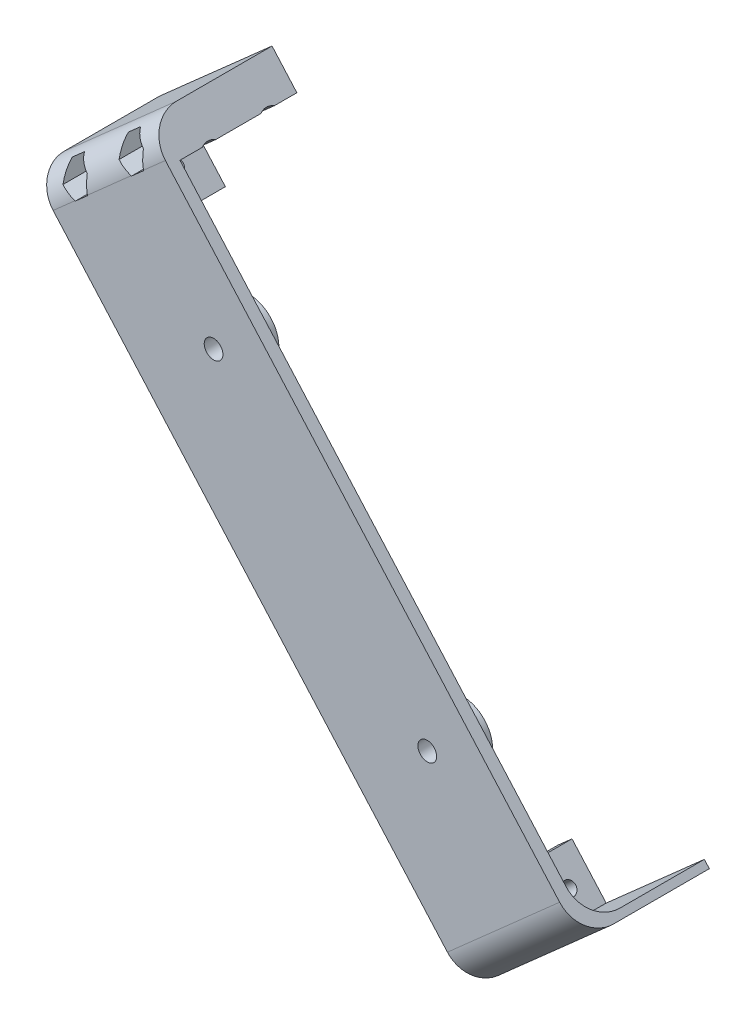
from build123d import *

# Parameters (mm, degrees)
SKETCH1_R                   = 10.2489
BOSS_EXTRUDE1_DEPTH         = 2.9845
BOSS_EXTRUDE1_2_DEPTH       = 2.9845
SKETCH2_R                   = 10.2489
BOSS_EXTRUDE2_DEPTH         = 5.08
BOSS_EXTRUDE3_DEPTH         = 3.81
F_1_4_0_25_DIAMETER_HOLE1_D = 6.35
BOSS_EXTRUDE4_DEPTH         = 17.78
SKETCH8_R                   = 2.25
CUT_EXTRUDE1_DEPTH          = 17.78
SKETCH9_W                   = 17.78
SKETCH9_H                   = 2.54
BOSS_EXTRUDE5_DEPTH         = 17.78
CUT_EXTRUDE2_REACH          = 251.195
CUT_EXTRUDE3_DEPTH          = 20
BOSS_EXTRUDE6_DEPTH         = 2.54
BOSS_EXTRUDE7_DEPTH         = 39.624
F_6_CLEARANCE_HOLE1_D       = 3.7973
CUT_EXTRUDE4_DEPTH          = 6.35
SKETCH17_W                  = 39.624
SKETCH17_H                  = 20
BOSS_EXTRUDE8_DEPTH         = 6.35
M4_CLEARANCE_HOLE1_D        = 4.5
SKETCH21_R                  = 4.308
CUT_EXTRUDE5_DEPTH          = 195.822050963
FILLET2_R                   = 11
CUT_EXTRUDE6_DEPTH          = 6.35
BOSS_EXTRUDE9_DEPTH         = 21.844
CUT_EXTRUDE7_DEPTH          = 195.822050963


with BuildPart() as part:
    # Sketch1 → Boss-Extrude1 (new body)
    with BuildSketch(Plane.XY):
        Circle(SKETCH1_R)
    extrude(amount=BOSS_EXTRUDE1_DEPTH)



with BuildPart() as body_2:
    # Sketch1 → Boss-Extrude1 2 (new body)
    with BuildSketch(Plane.XY):
        with Locations((-72.411066703, 81.765798589)):
            Circle(SKETCH1_R)
    extrude(amount=BOSS_EXTRUDE1_2_DEPTH)


with BuildPart() as part_1:
    add(part.part)

    add(body_2.part)  # Boss-Extrude2 merges body 2
    # Sketch2 → Boss-Extrude2 (add)
    with BuildSketch(Plane.XY.offset(2.9845)):
        with Locations((-72.411066703, 81.765798589)):
            Circle(SKETCH2_R)
        Circle(SKETCH2_R)
    extrude(amount=BOSS_EXTRUDE2_DEPTH)

    # Sketch3 → Boss-Extrude3 (add)
    with BuildSketch(Plane.XY.offset(8.0645)):
        Polygon((-134.069705847, 103.500499391), (-96.039101852, 137.180065299), (52.150988145, -30.154592279), (14.12038415, -63.834158187), align=None)
    extrude(amount=BOSS_EXTRUDE3_DEPTH)

    # 1/4 (0.25) Diameter Hole1 (through all)
    with Locations(Plane.XY.offset(11.8745)):
        with Locations((0, 0), (-72.411066703, 81.765798589)):
            Hole(F_1_4_0_25_DIAMETER_HOLE1_D / 2)

    # Sketch7 → Boss-Extrude4 (add)
    with BuildSketch(Plane(origin=(0, 0, 8.0645), x_dir=(-1, 0, 0), z_dir=(0, 0, -1))):
        Polygon((66.604496657, 27.319509971), (61.850671158, 31.529455709), (48.59099954, 16.556776971), (53.34482504, 12.346831233), align=None)
        Polygon((-14.12038415, -63.834158187), (-0.860712533, -48.861479449), (-5.614538032, -44.65153371), (-18.87420965, -59.624212449), align=None)
    extrude(amount=BOSS_EXTRUDE4_DEPTH)

    # Sketch8 → Cut-Extrude1 (cut)
    with BuildSketch(Plane(origin=(-19.015301997, -16.839782954, 0), x_dir=(0, 0, -1), z_dir=(0.7486339369082557, 0.6629835808745536, 0))):
        with Locations(Location((4.6355, -47.15, 0), (0, 0, 90))):
            Circle(SKETCH8_R)
        with Locations(Location((0, 54.61, 0), (0, 0, 90))):
            Circle(SKETCH8_R)
    extrude(amount=-CUT_EXTRUDE1_DEPTH, mode=Mode.SUBTRACT)

    # Sketch9 → Boss-Extrude5 (add)
    with BuildSketch(Plane(origin=(-19.015301997, -16.839782954, 0), x_dir=(0, 0, -1), z_dir=(0.7486339369082557, 0.6629835808745536, 0))):
        with Locations((0.8255, -55.88)):
            Rectangle(SKETCH9_W, SKETCH9_H)
        with Locations((0.8255, 45.88)):
            Rectangle(SKETCH9_W, SKETCH9_H)
        with Locations((0.8255, 63.34)):
            Rectangle(SKETCH9_W, SKETCH9_H)
        with Locations((0.8255, -38.42)):
            Rectangle(SKETCH9_W, SKETCH9_H)
    extrude(amount=BOSS_EXTRUDE5_DEPTH)

    # Cut-Extrude2: up to this face of the body (flat: up to its plane)
    cut_extrude2_end = Plane(part_1.part.faces().sort_by_distance((9.892980981, -40.862582546, -0.8255))[0])
    # Sketch10 → Cut-Extrude2 (cut, up to the picked face)
    with BuildSketch(Plane(origin=(37.889511647, -42.784429494, 0), x_dir=(0.7486339369082557, 0.6629835808745536, 0), z_dir=(0.6629835808745536, -0.7486339369082557, 0)), mode=Mode.PRIVATE) as cut_extrude2_sk1:
        Polygon((-7.62, 8.0645), (-7.62, -9.7155), (-25.4, -9.7155), align=None)
    cut_extrude2_tool1 = split(extrude(cut_extrude2_sk1.sketch, amount=-CUT_EXTRUDE2_REACH, mode=Mode.PRIVATE), bisect_by=cut_extrude2_end, keep=Keep.BOTH, mode=Mode.PRIVATE)
    add(cut_extrude2_tool1.solids().sort_by(Axis((27.748017, -51.765647, -3.788833), (-0.6629835808745536, 0.7486339369082557, 0)))[0], mode=Mode.SUBTRACT)

    # Sketch11 → Cut-Extrude3 (cut)
    with BuildSketch(Plane(origin=(-29.575697543, 33.396559925, 0), x_dir=(0.748633936908256, 0.6629835808745533, 0), z_dir=(0.6629835808745533, -0.748633936908256, 0))):
        Polygon((-7.62, -9.7155), (-7.62, 8.0645), (-25.4, -9.7155), align=None)
    extrude(amount=-CUT_EXTRUDE3_DEPTH, mode=Mode.SUBTRACT)

    # Sketch12 → Boss-Extrude6 (add)
    with BuildSketch(Plane(origin=(37.889511647, -42.784429494, 0), x_dir=(0.7486339369082557, 0.6629835808745536, 0), z_dir=(0.6629835808745536, -0.7486339369082557, 0))):
        Polygon((-25.4, -9.7155), (19.05, -9.7155), (19.05, 8.0645), (-7.62, 8.0645), align=None)
    extrude(amount=-BOSS_EXTRUDE6_DEPTH)

    # Sketch13 → Boss-Extrude7 (add)
    with BuildSketch(Plane(origin=(0, 0, 8.0645), x_dir=(-1, 0, 0), z_dir=(0, 0, -1))):
        Polygon((96.039101852, 137.180065299), (134.069705847, 103.500499391), (125.64981437, 93.992848392), (87.619210375, 127.6724143), align=None)
    extrude(amount=BOSS_EXTRUDE7_DEPTH)

    # #6 Clearance Hole1 (through all)
    with Locations(Plane.XY.offset(11.8745)):
        with Locations((-120.35210911, 107.166565368), (-101.336807112, 124.006348323)):
            Hole(F_6_CLEARANCE_HOLE1_D / 2)

    # Sketch14 → Cut-Extrude4 (cut)
    with BuildSketch(Plane.XY.offset(11.8745)):
        Polygon((-106.55273324, 125.748757468), (-105.45374076, 120.360428364), (-97.219873465, 127.652268281), (-102.435799592, 129.394677426), align=None)
        Polygon((-97.219873465, 127.652268281), (-105.45374076, 120.360428364), (-100.237814632, 118.618019219), (-96.120880984, 122.263939177), align=None)
        Polygon((-125.568035237, 108.908974514), (-124.469042757, 103.52064541), (-116.235175462, 110.812485327), (-121.45110159, 112.554894472), align=None)
        Polygon((-116.235175462, 110.812485327), (-124.469042757, 103.52064541), (-119.25311663, 101.778236265), (-115.136182982, 105.424156223), align=None)
    extrude(amount=-CUT_EXTRUDE4_DEPTH, mode=Mode.SUBTRACT)

    # Sketch17 → Boss-Extrude8 (add)
    with BuildSketch(Plane(origin=(-23.769127497, -21.049728693, 0), x_dir=(0, 0, 1), z_dir=(-0.7486339369082559, -0.6629835808745536, 0))):
        with Locations((-11.7475, 150.02)):
            Rectangle(SKETCH17_W, SKETCH17_H)
    extrude(amount=-BOSS_EXTRUDE8_DEPTH)

    # M4 Clearance Hole1 (through all)
    with Locations(Plane(origin=(-19.015301997, -16.839782954, 0), x_dir=(0, 0, -1), z_dir=(0.7486339369082559, 0.6629835808745536, 0))):
        with Locations((1.8415, 150.02), (21.6535, 150.02)):
            Hole(M4_CLEARANCE_HOLE1_D / 2)

    # Sketch21 → Cut-Extrude5 (cut, through all)
    with BuildSketch(Plane(origin=(-19.015301997, -16.839782954, 0), x_dir=(0, 0, -1), z_dir=(0.7486339369082559, 0.6629835808745536, 0))):
        with Locations((21.6535, 150.02)):
            Circle(SKETCH21_R)
        with Locations((1.8415, 150.02)):
            Circle(SKETCH21_R)
    extrude(amount=CUT_EXTRUDE5_DEPTH, mode=Mode.SUBTRACT)

    # Fillet2
    # the kernel refuses this fillet: 11 mm, written as the material it adds along each edge
    with BuildSketch(Plane(origin=(50.46700985, -28.253062079, 8.0645), x_dir=(-0.6629835808745533, 0.7486339369082559, 1.2918958832001814e-15), z_dir=(-0.748633936908256, -0.6629835808745534, 0))) as fillet2_piece_1:
        with BuildLine():
            CenterArc((FILLET2_R, FILLET2_R), FILLET2_R, 180, 90)
            Line((0, FILLET2_R), (0, 0))
            Line((0, 0), (FILLET2_R, 0))
        make_face()
    extrude(amount=44.45)
    # the kernel refuses this fillet: 11 mm, written as the material it takes off along each edge
    with BuildSketch(Plane(origin=(72.73842141, -11.922543805, 11.8745), x_dir=(-0.6629835808745536, 0.7486339369082557, 0), z_dir=(-0.7486339369082559, -0.6629835808745537, 0))) as fillet2_2_piece_1:
        with BuildLine():
            CenterArc((FILLET2_R, FILLET2_R), FILLET2_R, 180, 90)
            Line((0, FILLET2_R), (0, 0))
            Line((0, 0), (FILLET2_R, 0))
        make_face()
    extrude(amount=105.8, mode=Mode.SUBTRACT)
    with BuildSketch(Plane(origin=(-154.657139112, 85.268450917, 11.8745), x_dir=(0, 0, -1), z_dir=(0.7486339369082557, 0.6629835808745537, 0))) as fillet2_2_piece_2:
        with BuildLine():
            CenterArc((FILLET2_R, -FILLET2_R), FILLET2_R, 90, 90)
            Line((0, -FILLET2_R), (0, 0))
            Line((0, 0), (FILLET2_R, 0))
        make_face()
    extrude(amount=105.8, mode=Mode.SUBTRACT)

    # Sketch22 → Cut-Extrude6 (cut)
    with BuildSketch(Plane.XY.offset(5.5245)):
        Polygon((-121.45110159, 112.554894472), (-125.568035237, 108.908974514), (-124.469042757, 103.52064541), (-119.25311663, 101.778236265), (-115.136182982, 105.424156223), (-116.235175462, 110.812485327), align=None)
        Polygon((-102.435799592, 129.394677426), (-106.55273324, 125.748757468), (-105.45374076, 120.360428364), (-100.237814632, 118.618019219), (-96.120880984, 122.263939177), (-97.219873465, 127.652268281), align=None)
    extrude(amount=-CUT_EXTRUDE6_DEPTH, mode=Mode.SUBTRACT)

    # Sketch24 → Boss-Extrude9 (add)
    with BuildSketch(Plane(origin=(0, 0, -9.7155), x_dir=(-1, 0, 0), z_dir=(0, 0, -1))):
        Polygon((-7.298516327, -46.55306391), (-17.190231354, -57.722682249), (-50.46700985, -28.253062079), (-52.150988145, -30.154592279), (-14.12038415, -63.834158187), (-0.860712533, -48.861479449), (-5.614538032, -44.65153371), align=None)
    extrude(amount=BOSS_EXTRUDE9_DEPTH)

    # Sketch25 → Cut-Extrude7 (cut, through all)
    with BuildSketch(Plane(origin=(-19.015301997, -16.839782954, 0), x_dir=(0, 0, -1), z_dir=(0.7486339369082557, 0.6629835808745536, 0))):
        with BuildLine():
            ThreePointArc((26.1535, -47.15), (25.494490258, -45.559009742), (23.9035, -44.9))
            Line((23.9035, -44.9), (23.9035, -47.15))
            Line((23.9035, -47.15), (21.6535, -47.15))
            ThreePointArc((21.6535, -47.15), (23.9035, -49.4), (26.1535, -47.15))
        make_face()
        with BuildLine():
            Line((23.9035, -47.15), (23.9035, -44.9))
            ThreePointArc((23.9035, -44.9), (22.312509742, -45.559009742), (21.6535, -47.15))
            Line((21.6535, -47.15), (23.9035, -47.15))
        make_face()
    extrude(amount=-CUT_EXTRUDE7_DEPTH, mode=Mode.SUBTRACT)


solid = part_1.part
